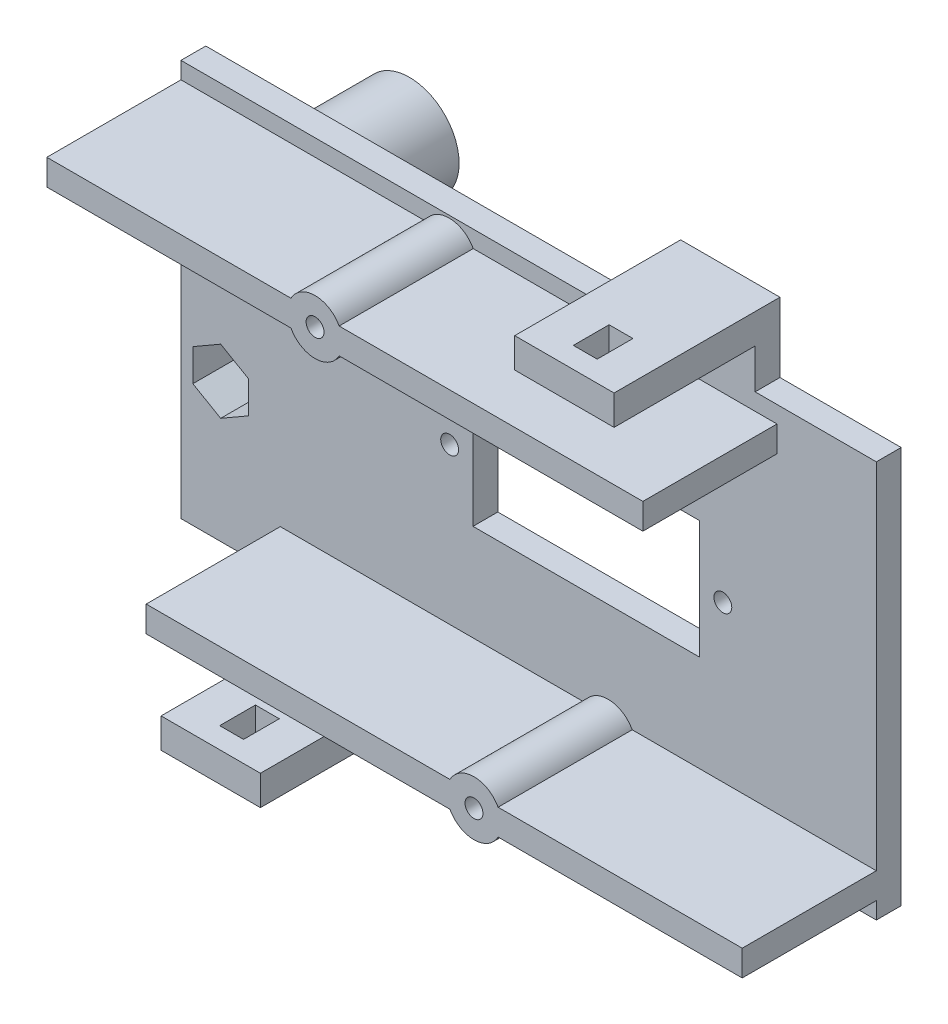
from build123d import *

# Parameters (mm, degrees)
BOSS_EXTRUDE1_START     = -2.5
SKETCH1_W               = 70
SKETCH1_H               = 39.95
BOSS_EXTRUDE1_DEPTH     = 2.5
SKETCH2_W               = 60
SKETCH2_H               = 2.6
BOSS_EXTRUDE2_DEPTH     = 13.5
SKETCH3_W               = 60
SKETCH3_H               = 2.6
BOSS_EXTRUDE3_DEPTH     = 13.5
SKETCH4_R               = 2.75
BOSS_EXTRUDE4_DEPTH     = 13.5
BOSS_EXTRUDE5_START     = -19
SKETCH5_R               = 5
BOSS_EXTRUDE5_DEPTH     = 16.5
CUT_EXTRUDE1_DEPTH      = 46.343143087
CUT_EXTRUDE1_DEPTH_BACK = 46.343143087
SKETCH6_W               = 22.8
SKETCH6_H               = 11.9
CUT_EXTRUDE2_DEPTH      = 46.343143087
CUT_EXTRUDE2_DEPTH_BACK = 46.343143087
SKETCH7_R               = 0.9
CUT_EXTRUDE3_DEPTH      = 46.343143087
CUT_EXTRUDE3_DEPTH_BACK = 46.343143087
SKETCH8_R               = 0.9
BOSS_EXTRUDE6_START     = -2.5
SKETCH9_W               = 10
SKETCH9_H               = 7
BOSS_EXTRUDE6_DEPTH     = 2.5
SKETCH10_W              = 10
SKETCH10_H              = 3
BOSS_EXTRUDE7_DEPTH     = 14.2
BOSS_EXTRUDE8_START     = -2.5
SKETCH11_W              = 10
SKETCH11_H              = 7
BOSS_EXTRUDE8_DEPTH     = 2.5
SKETCH12_W              = 10
SKETCH12_H              = 3
BOSS_EXTRUDE9_DEPTH     = 14.2
CUT_EXTRUDE4_DEPTH      = 49.832884668
CUT_EXTRUDE4_DEPTH_BACK = 49.832884668
SKETCH13_R              = 1.725
CUT_EXTRUDE5_START      = -4.2
CUT_EXTRUDE5_DEPTH      = 4.2
CUT_EXTRUDE6_START      = 25.475
SKETCH15_W              = 2.4
SKETCH15_H              = 3.6
CUT_EXTRUDE6_DEPTH      = 2
CUT_EXTRUDE7_START      = -25.475
SKETCH16_W              = 2.4
SKETCH16_H              = 3.6
CUT_EXTRUDE7_DEPTH      = 2


with BuildPart() as part:
    # Sketch1 → Boss-Extrude1 (new body)
    with BuildSketch(Plane.XY.offset(BOSS_EXTRUDE1_START)):
        Rectangle(SKETCH1_W, SKETCH1_H)
    extrude(amount=BOSS_EXTRUDE1_DEPTH)

    # Sketch2 → Boss-Extrude2 (add)
    with BuildSketch(Plane.XY):
        with Locations((-5, 16.975)):
            Rectangle(SKETCH2_W, SKETCH2_H)
    extrude(amount=BOSS_EXTRUDE2_DEPTH)

    # Sketch3 → Boss-Extrude3 (add)
    with BuildSketch(Plane.XY):
        with Locations((5, -16.975)):
            Rectangle(SKETCH3_W, SKETCH3_H)
    extrude(amount=BOSS_EXTRUDE3_DEPTH)

    # Sketch4 → Boss-Extrude4 (add)
    with BuildSketch(Plane.XY):
        with Locations((-8, 16.975)):
            Circle(SKETCH4_R)
        with Locations((8, -16.975)):
            Circle(SKETCH4_R)
    extrude(amount=BOSS_EXTRUDE4_DEPTH)

    # Sketch5 → Boss-Extrude5 (add)
    with BuildSketch(Plane.XY.offset(BOSS_EXTRUDE5_START)):
        with Locations((-31, 6)):
            Circle(SKETCH5_R)
        with Locations((-31, -6)):
            Circle(SKETCH5_R)
    extrude(amount=BOSS_EXTRUDE5_DEPTH)

    # Sketch6 → Cut-Extrude1 (cut, two sides: drawn at the far end of the back side and taken through both)
    with BuildSketch(Plane.XY.offset(-CUT_EXTRUDE1_DEPTH_BACK)):
        with Locations((5.8, 0)):
            Rectangle(SKETCH6_W, SKETCH6_H)
    extrude(amount=CUT_EXTRUDE1_DEPTH + CUT_EXTRUDE1_DEPTH_BACK, mode=Mode.SUBTRACT)

    # Sketch7 → Cut-Extrude2 (cut, two sides: drawn at the far end of the back side and taken through both)
    with BuildSketch(Plane.XY.offset(-CUT_EXTRUDE2_DEPTH_BACK)):
        with Locations((-7.95, 0)):
            Circle(SKETCH7_R)
        with Locations((19.55, 0)):
            Circle(SKETCH7_R)
    extrude(amount=CUT_EXTRUDE2_DEPTH + CUT_EXTRUDE2_DEPTH_BACK, mode=Mode.SUBTRACT)

    # Sketch8 → Cut-Extrude3 (cut, two sides: drawn at the far end of the back side and taken through both)
    with BuildSketch(Plane.XY.offset(-CUT_EXTRUDE3_DEPTH_BACK)):
        with Locations((-8, 16.975)):
            Circle(SKETCH8_R)
        with Locations((8, -16.975)):
            Circle(SKETCH8_R)
    extrude(amount=CUT_EXTRUDE3_DEPTH + CUT_EXTRUDE3_DEPTH_BACK, mode=Mode.SUBTRACT)

    # Sketch9 → Boss-Extrude6 (add)
    with BuildSketch(Plane.XY.offset(BOSS_EXTRUDE6_START)):
        with Locations((17.8, 23.475)):
            Rectangle(SKETCH9_W, SKETCH9_H)
    extrude(amount=BOSS_EXTRUDE6_DEPTH)

    # Sketch10 → Boss-Extrude7 (add)
    with BuildSketch(Plane.XY):
        with Locations((17.8, 25.475)):
            Rectangle(SKETCH10_W, SKETCH10_H)
    extrude(amount=BOSS_EXTRUDE7_DEPTH)

    # Sketch11 → Boss-Extrude8 (add)
    with BuildSketch(Plane.XY.offset(BOSS_EXTRUDE8_START)):
        with Locations((-17.8, -23.475)):
            Rectangle(SKETCH11_W, SKETCH11_H)
    extrude(amount=BOSS_EXTRUDE8_DEPTH)

    # Sketch12 → Boss-Extrude9 (add)
    with BuildSketch(Plane.XY):
        with Locations((-17.8, -25.475)):
            Rectangle(SKETCH12_W, SKETCH12_H)
    extrude(amount=BOSS_EXTRUDE9_DEPTH)

    # Sketch13 → Cut-Extrude4 (cut, two sides: drawn at the far end of the back side and taken through both)
    with BuildSketch(Plane.XY.offset(-CUT_EXTRUDE4_DEPTH_BACK)):
        with Locations((-31, 6)):
            Circle(SKETCH13_R)
        with Locations((-31, -6)):
            Circle(SKETCH13_R)
    extrude(amount=CUT_EXTRUDE4_DEPTH + CUT_EXTRUDE4_DEPTH_BACK, mode=Mode.SUBTRACT)

    # Sketch14 → Cut-Extrude5 (cut)
    with BuildSketch(Plane.XY.offset(CUT_EXTRUDE5_START)):
        Polygon((-28.2, 7.616580754), (-31, 9.233161507), (-33.8, 7.616580754), (-33.8, 4.383419246), (-31, 2.766838493), (-28.2, 4.383419246), align=None)
        Polygon((-28.2, -4.383419246), (-31, -2.766838493), (-33.8, -4.383419246), (-33.8, -7.616580754), (-31, -9.233161507), (-28.2, -7.616580754), align=None)
    extrude(amount=CUT_EXTRUDE5_DEPTH, mode=Mode.SUBTRACT)

    # Sketch15 → Cut-Extrude6 (cut, symmetric)
    with BuildSketch(Plane(origin=(0, 0, 0), x_dir=(1, 0, 0), z_dir=(0, 1, 0)).offset(CUT_EXTRUDE6_START)):
        with Locations((17.8, -10.3)):
            Rectangle(SKETCH15_W, SKETCH15_H)
    extrude(amount=CUT_EXTRUDE6_DEPTH, both=True, mode=Mode.SUBTRACT)

    # Sketch16 → Cut-Extrude7 (cut, symmetric)
    with BuildSketch(Plane(origin=(0, 0, 0), x_dir=(1, 0, 0), z_dir=(0, 1, 0)).offset(CUT_EXTRUDE7_START)):
        with Locations((-17.8, -10.3)):
            Rectangle(SKETCH16_W, SKETCH16_H)
    extrude(amount=CUT_EXTRUDE7_DEPTH, both=True, mode=Mode.SUBTRACT)


solid = part.part
